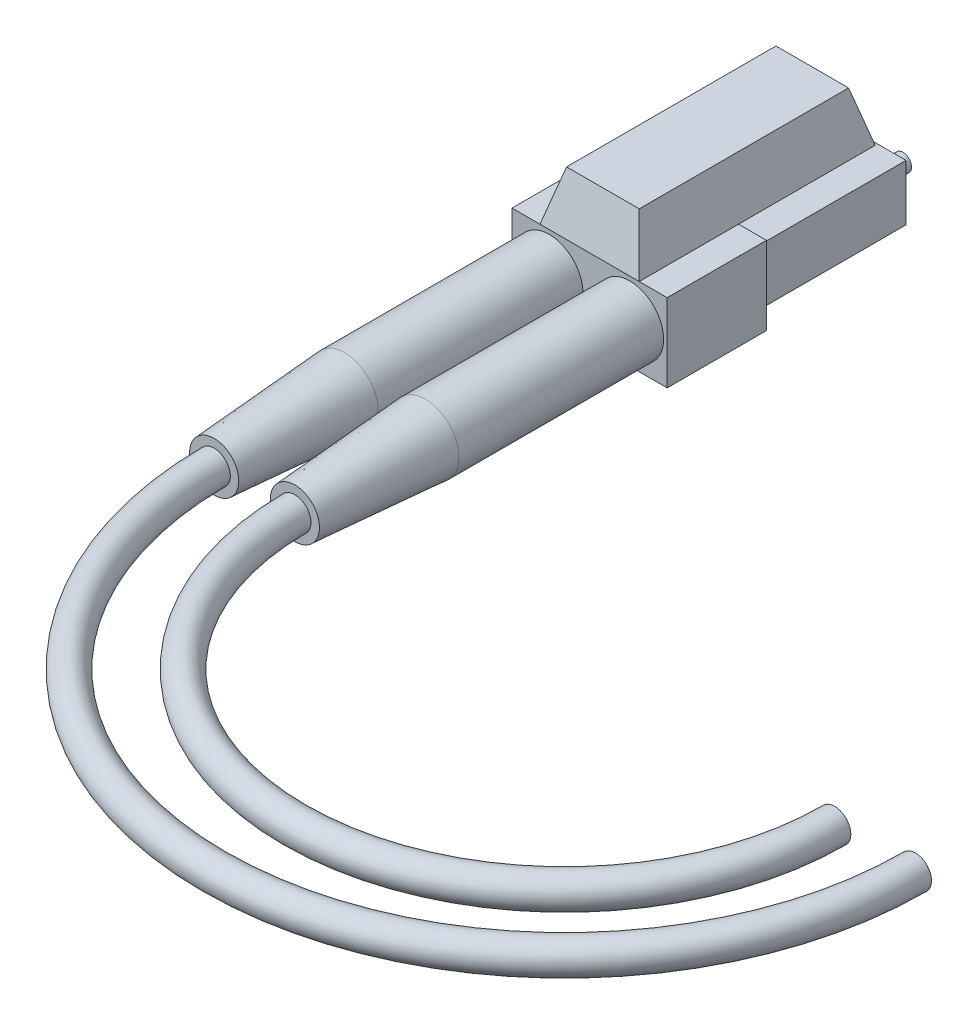
from build123d import *

# Parameters (mm, degrees)
SKETCH1_W                     = 4.5
SKETCH1_H                     = 4.5
BOSS_EXTRUDE1_DEPTH           = 12
BOSS_EXTRUDE1_2_DEPTH         = 12
SKETCH2_R                     = 0.691748062
BOSS_EXTRUDE2_DEPTH           = 2
SKETCH3_W                     = 12.5
SKETCH3_H                     = 6.3
BOSS_EXTRUDE3_DEPTH           = 8
SKETCH4_R                     = 2.715
BOSS_EXTRUDE4_DEPTH           = 16.5
SKETCH5_R                     = 2.715
BOSS_EXTRUDE5_DEPTH           = 10.5
BOSS_EXTRUDE5_DRAFT           = 4
BOSS_EXTRUDE5_PROFILE_2_DEPTH = 10.5
BOSS_EXTRUDE5_PROFILE_2_DRAFT = 4
SKETCH8_W                     = 8
SKETCH8_H                     = 19.014368052
BOSS_EXTRUDE8_DEPTH           = 4
BOSS_EXTRUDE8_TAPER           = 15
SKETCH9_R                     = 1.3


with BuildPart() as part:
    # Sketch1 → Boss-Extrude1 (new body)
    with BuildSketch(Plane.XY):
        with Locations((3.245938438, 2.25)):
            Rectangle(SKETCH1_W, SKETCH1_H)
    extrude(amount=-BOSS_EXTRUDE1_DEPTH)



with BuildPart() as body_2:
    # Sketch1 → Boss-Extrude1 2 (new body)
    with BuildSketch(Plane.XY):
        with Locations((-3.254061562, 2.25)):
            Rectangle(SKETCH1_W, SKETCH1_H)
    extrude(amount=-BOSS_EXTRUDE1_2_DEPTH)


with BuildPart() as part_1:
    add(part.part)

    add(body_2.part)  # Boss-Extrude2 merges body 2
    # Sketch2 → Boss-Extrude2 (add)
    with BuildSketch(Plane(origin=(0, 0, -12), x_dir=(-1, 0, 0), z_dir=(0, 0, -1))):
        with Locations((3.25, 2.25)):
            Circle(SKETCH2_R)
        with Locations((-3.25, 2.25)):
            Circle(SKETCH2_R)
    extrude(amount=BOSS_EXTRUDE2_DEPTH)

    # Sketch3 → Boss-Extrude3 (add)
    with BuildSketch(Plane.XY):
        with Locations((0, 2.15)):
            Rectangle(SKETCH3_W, SKETCH3_H)
    extrude(amount=BOSS_EXTRUDE3_DEPTH)

    # Sketch4 → Boss-Extrude4 (add)
    with BuildSketch(Plane.XY.offset(8)):
        with Locations((3.25, 2.25)):
            Circle(SKETCH4_R)
        with Locations((-3.25, 2.25)):
            Circle(SKETCH4_R)
    extrude(amount=BOSS_EXTRUDE4_DEPTH)


with BuildPart() as boss_extrude5_tool:
    # Sketch5 → Boss-Extrude5 (with draft: the straight prism first)
    with BuildSketch(Plane.XY.offset(24.5)):
        with Locations((-3.25, 2.25)):
            Circle(SKETCH5_R)
    extrude(amount=BOSS_EXTRUDE5_DEPTH)
    # Boss-Extrude5: the draft: its side faces are tilted about the plane it starts from
    boss_extrude5_sides = [boss_extrude5_tool.faces().sort_by_distance(p)[0] for p in [
        (-5.965, 2.25, 29.75),
    ]]
    draft(boss_extrude5_sides, Plane.XY.offset(24.5), BOSS_EXTRUDE5_DRAFT)


with BuildPart() as part_2:
    add(part_1.part)

    # Boss-Extrude5: add boss_extrude5_tool
    add(boss_extrude5_tool.part)


with BuildPart() as boss_extrude5_profile_2_tool:
    # Sketch5 → Boss-Extrude5 profile 2 (with draft: the straight prism first)
    with BuildSketch(Plane.XY.offset(24.5)):
        with Locations((3.25, 2.25)):
            Circle(SKETCH5_R)
    extrude(amount=BOSS_EXTRUDE5_PROFILE_2_DEPTH)
    # Boss-Extrude5 profile 2: the draft: its side faces are tilted about the plane it starts from
    boss_extrude5_profile_2_sides = [boss_extrude5_profile_2_tool.faces().sort_by_distance(p)[0] for p in [
        (0.535, 2.25, 29.75),
    ]]
    draft(boss_extrude5_profile_2_sides, Plane.XY.offset(24.5), BOSS_EXTRUDE5_PROFILE_2_DRAFT)


with BuildPart() as part_3:
    add(part_2.part)

    # Boss-Extrude5 profile 2: add boss_extrude5_profile_2_tool
    add(boss_extrude5_profile_2_tool.part)

    # Sketch8 → Boss-Extrude8 (add)
    with BuildSketch(Plane(origin=(0, 5.3, 0), x_dir=(1, 0, 0), z_dir=(0, 1, 0))):
        with Locations((0, 1.507184026)):
            Rectangle(SKETCH8_W, SKETCH8_H)
    extrude(amount=BOSS_EXTRUDE8_DEPTH, taper=BOSS_EXTRUDE8_TAPER)

    # Sweep1: sweep along a path in Sketch10
    with BuildLine(Plane.XZ.offset(-2.25)) as sweep1_path:
        ThreePointArc((0, 35), (25, 60), (50, 35))
    # Sketch9 → Sweep1 (sweep)
    with BuildSketch(Plane.XY.offset(35)):
        with Locations((-3.25, 2.25)):
            Circle(SKETCH9_R)
        with Locations((3.25, 2.25)):
            Circle(SKETCH9_R)
    sweep(path=sweep1_path.line)


solid = part_3.part
